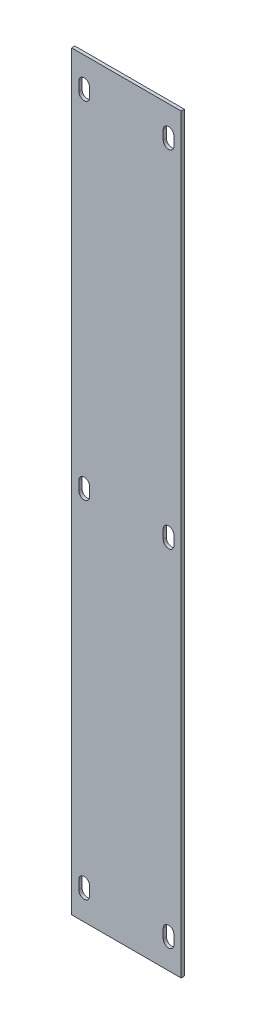
from build123d import *

# Parameters (mm, degrees)
SKETCH1_W                  = 27.7
SKETCH1_H                  = 0.8128
BOSS_EXTRUDE1_DEPTH        = 190.09
M2_5_START                 = -0.4064
M2_5_CLEARANCE_SLOT2_DEPTH = 0.8128


# Read off the part's stored shape, not the designer's step: M2.5 Clearance Slot2
with BuildPart() as part:
    # Sketch1 → Boss-Extrude1 (new body)
    with BuildSketch(Plane(origin=(0, 0, 0), x_dir=(1, 0, 0), z_dir=(0, 1, 0))):
        Rectangle(SKETCH1_W, SKETCH1_H)
    extrude(amount=BOSS_EXTRUDE1_DEPTH)

    # M2.5 Clearance Slot2 outline → M2.5 Clearance Slot2 (cut)
    with BuildSketch(Plane.XY.offset(M2_5_START)):
        with BuildLine():
            ThreePointArc((-9.325, 96.195), (-10.675, 97.545), (-12.025, 96.195))
            Line((-12.025, 96.195), (-12.025, 93.895))
            ThreePointArc((-12.025, 93.895), (-10.675, 92.545), (-9.325, 93.895))
            Line((-9.325, 93.895), (-9.325, 96.195))
        make_face()
        with BuildLine():
            Line((-9.325, 181.44), (-9.325, 183.74))
            ThreePointArc((-9.325, 183.74), (-10.675, 185.09), (-12.025, 183.74))
            Line((-12.025, 183.74), (-12.025, 181.44))
            ThreePointArc((-12.025, 181.44), (-10.675, 180.09), (-9.325, 181.44))
        make_face()
        with BuildLine():
            Line((-9.325, 6.35), (-9.325, 8.65))
            ThreePointArc((-9.325, 8.65), (-10.675, 10), (-12.025, 8.65))
            Line((-12.025, 8.65), (-12.025, 6.35))
            ThreePointArc((-12.025, 6.35), (-10.675, 5), (-9.325, 6.35))
        make_face()
        with BuildLine():
            ThreePointArc((12.025, 96.195), (10.675, 97.545), (9.325, 96.195))
            Line((9.325, 96.195), (9.325, 93.895))
            ThreePointArc((9.325, 93.895), (10.675, 92.545), (12.025, 93.895))
            Line((12.025, 93.895), (12.025, 96.195))
        make_face()
        with BuildLine():
            Line((12.025, 181.44), (12.025, 183.74))
            ThreePointArc((12.025, 183.74), (10.675, 185.09), (9.325, 183.74))
            Line((9.325, 183.74), (9.325, 181.44))
            ThreePointArc((9.325, 181.44), (10.675, 180.09), (12.025, 181.44))
        make_face()
        with BuildLine():
            Line((12.025, 6.35), (12.025, 8.65))
            ThreePointArc((12.025, 8.65), (10.675, 10), (9.325, 8.65))
            Line((9.325, 8.65), (9.325, 6.35))
            ThreePointArc((9.325, 6.35), (10.675, 5), (12.025, 6.35))
        make_face()
    extrude(amount=M2_5_CLEARANCE_SLOT2_DEPTH, mode=Mode.SUBTRACT)


solid = part.part
